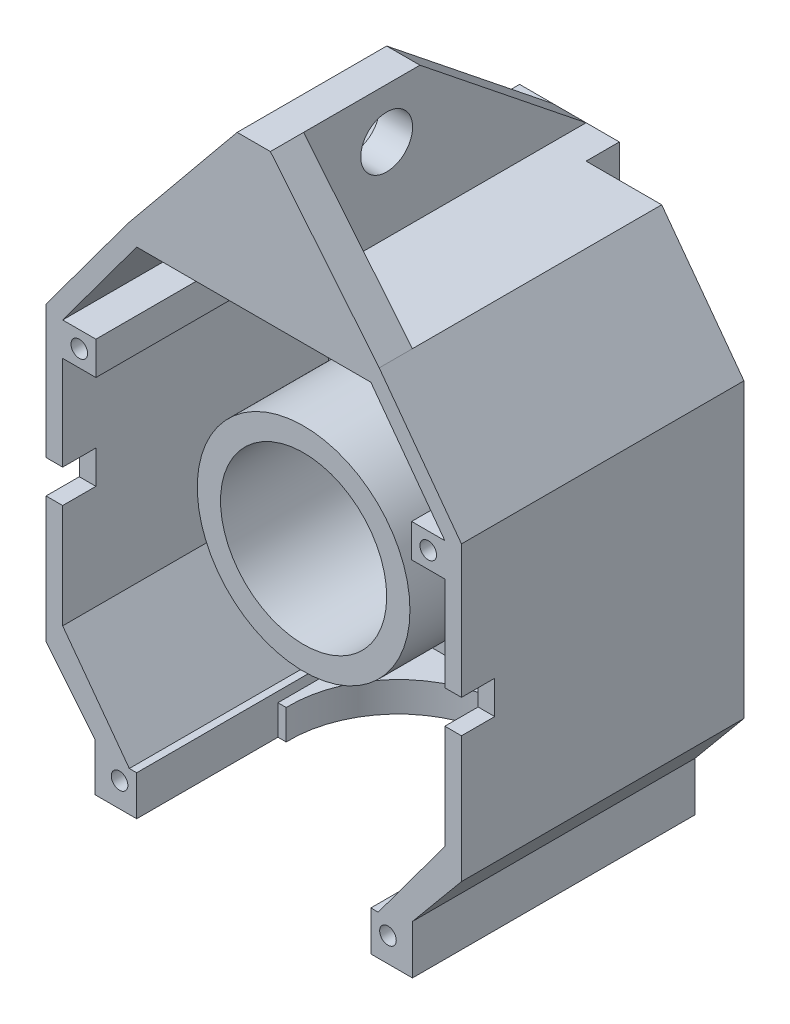
from build123d import *
from build123d.topology import SkipClean

# Parameters (mm, degrees)
ESTRUSIONE_ESTRUSIONE3_DEPTH       = 35
ESTRUSIONE_ESTRUSIONE3_DEPTH_BACK  = 35
SCHIZZO1_R                         = 32
SCHIZZO1_R_2                       = 25
SCHIZZO3D1_R                       = 32
ESTRUSIONE_ESTRUSIONE4_DEPTH       = 5
ESTRUSIONE_ESTRUSIONE13_DEPTH      = 80
TAGLIO_ESTRUSIONE1_START           = -73.5
TAGLIO_ESTRUSIONE1_OUTLINE_R       = 32.75
TAGLIO_ESTRUSIONE1_DEPTH           = 5
TAGLIO_ESTRUSIONE2_DEPTH           = 42.5
ESTRUSIONE_ESTRUSIONE14_DEPTH      = 80
SCHIZZO3D6_R                       = 2.5
TAGLIO_ESTRUSIONE3_DEPTH           = 136.020798627
SCHIZZO3D7_R                       = 4
TAGLIO_ESTRUSIONE4_DEPTH           = 3
TAGLIO_ESTRUSIONE5_DEPTH           = 42.5
TAGLIO_ESTRUSIONE6_DEPTH           = 10
ESTRUSIONE_ESTRUSIONE15_START      = 5
ESTRUSIONE_ESTRUSIONE15_DEPTH      = 5
TAGLIO_ESTRUSIONE7_START           = -3
TAGLIO_ESTRUSIONE7_DEPTH           = 3
TAGLIO_ESTRUSIONE8_START           = 3
TAGLIO_ESTRUSIONE8_DEPTH           = 3
TAGLIO_ESTRUSIONE9_DEPTH           = 10
ESTRUSIONE_ESTRUSIONE16_START      = -35
ESTRUSIONE_ESTRUSIONE16_OUTLINE_R  = 4
ESTRUSIONE_ESTRUSIONE16_DEPTH      = 10
TAGLIO_ESTRUSIONE10_DEPTH          = 80
ESTRUSIONE_ESTRUSIONE17_DEPTH      = 85
TAGLIO_ESTRUSIONE11_DEPTH          = 85
ESTRUSIONE_ESTRUSIONE18_DEPTH      = 85
ESTRUSIONE_ESTRUSIONE19_DEPTH      = 85
ESTRUSIONE_ESTRUSIONE21_DEPTH      = 85
TAGLIO_ESTRUSIONE15_START          = 26
TAGLIO_ESTRUSIONE15_DEPTH          = 26
ESTRUSIONE_ESTRUSIONE22_DEPTH      = 85
SCHIZZO3D26_R                      = 4
TAGLIO_ESTRUSIONE16_DEPTH          = 3
SCHIZZO3D27_R                      = 2.5
TAGLIO_ESTRUSIONE17_DEPTH          = 107
TAGLIO_ESTRUSIONE18_START          = -35
TAGLIO_ESTRUSIONE18_OUTLINE_R      = 3.3
TAGLIO_ESTRUSIONE18_DEPTH          = 5
ESTRUSIONE_ESTRUSIONE23_START      = -35
ESTRUSIONE_ESTRUSIONE23_OUTLINE_R  = 25
ESTRUSIONE_ESTRUSIONE23_DEPTH      = 10
ESTRUSIONE_ESTRUSIONE24_START      = 10
SCHIZZO3D31_R                      = 3.3
ESTRUSIONE_ESTRUSIONE24_DEPTH      = 10
TAGLIO_ESTRUSIONE19_DEPTH          = 5
ESTRUSIONE_ESTRUSIONE26_DEPTH      = 8
ESTRUSIONE_ESTRUSIONE26_DEPTH_BACK = 8
SCHIZZO3D36_R                      = 4
ESTRUSIONE_ESTRUSIONE28_DEPTH      = 40
TAGLIO_ESTRUSIONE20_DEPTH          = 40
ESTRUSIONE_ESTRUSIONE29_DEPTH      = 45
ESTRUSIONE_ESTRUSIONE30_DEPTH      = 10
SCHIZZO3D46_R                      = 7.8
TAGLIO_ESTRUSIONE21_DEPTH          = 10


# Read off the part's stored shape, not the designer's step: Taglio-Estrusione1, Estrusione-Estrusione16, Taglio-Estrusione18, Estrusione-Estrusione23
with BuildPart() as part:
    # Schizzo1 → Estrusione-Estrusione3 (new, two sides: drawn at the far end of the back side and taken through both)
    with BuildSketch(Plane.XY.offset(-ESTRUSIONE_ESTRUSIONE3_DEPTH_BACK)):
        Circle(SCHIZZO1_R)
        Circle(SCHIZZO1_R_2, mode=Mode.SUBTRACT)
    extrude(amount=ESTRUSIONE_ESTRUSIONE3_DEPTH + ESTRUSIONE_ESTRUSIONE3_DEPTH_BACK)

    # Schizzo3D1 → Estrusione-Estrusione4 (add)
    with BuildSketch(Plane(origin=(-62.5, 40, -35), x_dir=(0.6620037592711553, -0.749500515484051, 0), z_dir=(0, 0, 1))):
        Polygon((0, 0), (59.960041239, -52.960300742), (101.452901549, -56.587288919), (104.762920346, -52.839786342), (148.124166578, -3.747502577), (151.434185374, 0), (142.710511148, 40.727263694), (82.750469909, 93.687564436), (41.257609598, 97.314552613), (37.947590802, 93.567050035), (-5.41365543, 44.474766271), (-8.723674227, 40.727263694), align=None)
        with Locations(Location((71.355255574, 20.363631847, 0), (0, 0, 48.547129509))):
            Circle(SCHIZZO3D1_R, mode=Mode.SUBTRACT)
    extrude(amount=ESTRUSIONE_ESTRUSIONE4_DEPTH)

    # Schizzo3D2 → Estrusione-Estrusione13 (add)
    with BuildSketch(Plane(origin=(-37.75, 73.5, -30), x_dir=(0.4568693936855125, -0.889533786381064, 0), z_dir=(0, 0, 1))):
        Polygon((0, 0), (34.493639223, 67.159800872), (75.600538561, 73.870637396), (146.763241471, 37.321085901), (165.255105821, 0), (130.761466598, -67.159800872), (89.654567261, -73.870637396), (18.49186435, -37.321085901), align=None)
        Polygon((22.240991405, -33.625735993), (5.600144509, -0.040454124), (37.788832579, 62.631561059), (74.780971679, 68.67064944), (143.014114416, 33.625735993), (159.654961313, 0.040454124), (127.466273243, -62.631561059), (90.474134143, -68.67064944), align=None, mode=Mode.SUBTRACT)
    extrude(amount=ESTRUSIONE_ESTRUSIONE13_DEPTH)

    # Taglio-Estrusione1 outline → Taglio-Estrusione1 (cut)
    with BuildSketch(Plane(origin=(0, 0, 0), x_dir=(1, 0, 0), z_dir=(0, 1, 0)).offset(TAGLIO_ESTRUSIONE1_START)):
        with Locations((0, -7.5)):
            Circle(TAGLIO_ESTRUSIONE1_OUTLINE_R)
    extrude(amount=TAGLIO_ESTRUSIONE1_DEPTH, mode=Mode.SUBTRACT)

    # Schizzo3D4 → Taglio-Estrusione2 (cut)
    with BuildSketch(Plane(origin=(-32.75, -68.5, 50), x_dir=(0.997099088805763, -0.07611443425998218, 0), z_dir=(0, 0, -1))):
        Polygon((0, 0), (0.380572171, 4.985495444), (65.690562488, 0), (65.309990317, -4.985495444), align=None)
    extrude(amount=TAGLIO_ESTRUSIONE2_DEPTH, mode=Mode.SUBTRACT)

    # Schizzo3D5 → Estrusione-Estrusione14 (add)
    with BuildSketch(Plane(origin=(-57.5, -38.353317087, -30), x_dir=(0.8319168268807552, 0.5549003452446715, 0), z_dir=(0, 0, 1))):
        Polygon((0, 0), (5.549003452, 8.319168269), (13.868171721, 2.770164816), (8.319168269, -5.549003452), align=None)
        Polygon((42.564537786, 63.813539703), (50.883706055, 58.264536251), (45.334702602, 49.945367982), (37.015534334, 55.494371434), align=None)
        Polygon((95.670435091, -63.813539703), (101.219438544, -55.494371434), (92.900270275, -49.945367982), (87.351266822, -58.264536251), align=None)
        Polygon((132.685969425, -8.319168269), (124.366801156, -2.770164816), (129.915804608, 5.549003452), (138.234972877, 0), align=None)
    extrude(amount=ESTRUSIONE_ESTRUSIONE14_DEPTH)

    # Schizzo3D6 → Taglio-Estrusione3 (cut)
    with BuildSketch(Plane(origin=(-52.5, 33.353317087, 50), x_dir=(0.8440673996564301, -0.5362370975951147, 0), z_dir=(0, 0, -1))):
        with Locations(Location((0, 0, 0), (0, 0, 327.572152721))):
            Circle(SCHIZZO3D6_R)
        with Locations(Location((35.7705719, 56.304895247, 0), (0, 0, 327.572152721))):
            Circle(SCHIZZO3D6_R)
        with Locations(Location((124.397648864, 0, 0), (0, 0, 327.572152721))):
            Circle(SCHIZZO3D6_R)
        with Locations(Location((88.627076964, -56.304895247, 0), (0, 0, 327.572152721))):
            Circle(SCHIZZO3D6_R)
    extrude(amount=TAGLIO_ESTRUSIONE3_DEPTH, mode=Mode.SUBTRACT)

    # Schizzo3D7 → Taglio-Estrusione4 (cut)
    with BuildSketch(Plane(origin=(52.5, 33.353317087, -35), x_dir=(-0.8440673996564301, -0.5362370975951145, 0), z_dir=(0, 0, 1))):
        with Locations(Location((0, 0, 0), (0, 0, 147.572152721))):
            Circle(SCHIZZO3D7_R)
        with Locations(Location((35.7705719, 56.304895247, 0), (0, 0, 147.572152721))):
            Circle(SCHIZZO3D7_R)
        with Locations(Location((124.397648864, 0, 0), (0, 0, 147.572152721))):
            Circle(SCHIZZO3D7_R)
        with Locations(Location((88.627076964, -56.304895247, 0), (0, 0, 147.572152721))):
            Circle(SCHIZZO3D7_R)
    extrude(amount=TAGLIO_ESTRUSIONE4_DEPTH, mode=Mode.SUBTRACT)

    # Schizzo3D8 → Taglio-Estrusione5 (cut)
    with BuildSketch(Plane(origin=(-35.227450684, -68.5, 50), x_dir=(0.9974912873801347, -0.07078934666121361, 0), z_dir=(0, 0, -1))):
        Polygon((0, 0), (2.471235472, -0.175377115), (2.825182205, 4.812079322), (0.353946733, 4.987456437), align=None)
        Polygon((70.632097001, 0), (68.160861529, 0.175377115), (67.806914795, -4.812079322), (70.278150268, -4.987456437), align=None)
    extrude(amount=TAGLIO_ESTRUSIONE5_DEPTH, mode=Mode.SUBTRACT)

    # Schizzo3D9 → Taglio-Estrusione6 (cut)
    with BuildSketch(Plane(origin=(-62.5, 0, 50), x_dir=(0.9968152785361251, -0.07974522228289001, 0), z_dir=(0, 0, -1))):
        Polygon((0, 0), (0.797452223, 9.968152785), (5.781528616, 9.569426674), (4.984076393, -0.398726111), align=None)
        Polygon((124.601909817, -9.968152785), (125.39936204, 0), (120.415285647, 0.398726111), (119.617833424, -9.569426674), align=None)
    extrude(amount=TAGLIO_ESTRUSIONE6_DEPTH, mode=Mode.SUBTRACT)

    # Schizzo3D10 → Estrusione-Estrusione15 (add)
    with BuildSketch(Plane(origin=(-32.75, -73.5, 7.5), x_dir=(0.856419201008807, 0, -0.5162810786223304), z_dir=(0, -1, 0)).offset(ESTRUSIONE_ESTRUSIONE15_START)):
        with BuildLine():
            Line((0, 0), (-2.121736335, -1.279060911))
            Line((-2.121736335, -1.279060911), (-24.063682177, 35.118755132))
            Line((-24.063682177, 35.118755132), (-26.224041846, 33.81641065))
            Line((-26.224041846, 33.81641065), (17.659849836, -38.979221436))
            Line((17.659849836, -38.979221436), (82.319499513, 0))
            Line((82.319499513, 0), (38.43560783, 72.795632086))
            Line((38.43560783, 72.795632086), (36.27524816, 71.493287604))
            Line((36.27524816, 71.493287604), (58.217194001, 35.095471561))
            Line((58.217194001, 35.095471561), (56.095457666, 33.81641065))
            ThreePointArc((56.095457666, 33.81641065), (44.955934158, -11.139523508), (0, 0))
        make_face()
    extrude(amount=-ESTRUSIONE_ESTRUSIONE15_DEPTH)

    # Schizzo3D11 → Taglio-Estrusione7 (cut)
    with BuildSketch(Plane(origin=(32.75, -68.5, 7.5), x_dir=(-1, 0, 0), z_dir=(0, 1, 0)).offset(TAGLIO_ESTRUSIONE7_START)):
        with BuildLine():
            Line((0, 0), (-2.477450684, 0))
            ThreePointArc((-2.477450684, 0), (32.75, -35.227450684), (67.977450684, 0))
            Line((67.977450684, 0), (65.5, 0))
            ThreePointArc((65.5, 0), (32.75, -32.75), (0, 0))
        make_face()
    extrude(amount=TAGLIO_ESTRUSIONE7_DEPTH, mode=Mode.SUBTRACT)

    # Schizzo3D12 → Taglio-Estrusione8 (cut)
    with BuildSketch(Plane(origin=(35.227450684, -68.5, 7.5), x_dir=(-0.8827477435104474, 0, -0.46984723190332145), z_dir=(0, -1, 0)).offset(TAGLIO_ESTRUSIONE8_START)):
        with BuildLine():
            Line((0, 0), (17.619271196, 33.103040382))
            Line((17.619271196, 33.103040382), (79.813176398, 0))
            Line((79.813176398, 0), (62.193905202, -33.103040382))
            ThreePointArc((62.193905202, -33.103040382), (14.54543241, -47.648472792), (0, 0))
        make_face()
    extrude(amount=-TAGLIO_ESTRUSIONE8_DEPTH, mode=Mode.SUBTRACT)

    # Schizzo3D13 → Taglio-Estrusione9 (cut)
    with BuildSketch(Plane(origin=(32.75, -78.5, 7.5), x_dir=(-1, 0, 0), z_dir=(0, -1, 0))):
        with BuildLine():
            ThreePointArc((0, 0), (32.75, 32.75), (65.5, 0))
            ThreePointArc((65.5, 0), (32.75, 33.75), (0, 0))
        make_face()
    extrude(amount=-TAGLIO_ESTRUSIONE9_DEPTH, mode=Mode.SUBTRACT)

    # Estrusione-Estrusione16 outline → Estrusione-Estrusione16 (add)
    with BuildSketch(Plane.XY.offset(ESTRUSIONE_ESTRUSIONE16_START)):
        with Locations((52.5, -33.353317087)):
            Circle(ESTRUSIONE_ESTRUSIONE16_OUTLINE_R)
        with Locations((-52.5, -33.353317087)):
            Circle(ESTRUSIONE_ESTRUSIONE16_OUTLINE_R)
    extrude(amount=ESTRUSIONE_ESTRUSIONE16_DEPTH)

    # Schizzo3D15 → Taglio-Estrusione10 (cut)
    with BuildSketch(Plane(origin=(-57.5, -38.353317087, 50), x_dir=(0.9962405881956831, 0.08662961636484198, 0), z_dir=(0, 0, 1))):
        Polygon((0, 0), (0.866296164, 9.962405882), (10.828702046, 9.096109718), (9.962405882, -0.866296164), align=None)
        Polygon((104.605261761, -9.096109718), (105.471557924, 0.866296164), (115.433963806, 0), (114.567667643, -9.962405882), align=None)
    extrude(amount=-TAGLIO_ESTRUSIONE10_DEPTH, mode=Mode.SUBTRACT)

    # Schizzo3D16 → Estrusione-Estrusione17 (add)
    with BuildSketch(Plane(origin=(-62.5, -40, 50), x_dir=(0.9979469235950233, -0.06404637138221654, 0), z_dir=(0, 0, -1))):
        Polygon((0, 0), (0.512370971, 7.983575389), (27.164971657, 36.835808867), (26.8447398, 31.846074249), align=None)
        Polygon((102.163724437, 32.022528861), (101.84349258, 27.032794243), (124.397125498, -7.983575389), (124.909496469, 0), align=None)
    extrude(amount=ESTRUSIONE_ESTRUSIONE17_DEPTH)

    # Schizzo3D17 → Taglio-Estrusione11 (cut)
    with BuildSketch(Plane(origin=(-57.5, -38.353317087, -30), x_dir=(0.9996599089213338, -0.026078084580556556, 0), z_dir=(0, 0, -1))):
        Polygon((0, 0), (0.078234254, 2.998979727), (23.129376621, 32.554584597), (23.051142368, 29.55560487), align=None)
        Polygon((93.560316906, 30.71725572), (93.482082652, 27.718275993), (114.960889526, -2.998979727), (115.03912378, 0), align=None)
    extrude(amount=-TAGLIO_ESTRUSIONE11_DEPTH, mode=Mode.SUBTRACT)

    # Schizzo3D18 → Estrusione-Estrusione18 (add)
    with BuildSketch(Plane(origin=(35.227450684, -78.5, 50), x_dir=(-0.9923639585819584, 0.12334412717087637, 0), z_dir=(0, 0, -1))):
        Polygon((0, 0), (-9.923639586, 1.233441272), (-8.690198314, 11.157080858), (1.233441272, 9.923639586), align=None)
        Polygon((69.916904823, -8.690198314), (79.840544409, -9.923639586), (81.07398568, 0), (71.150346094, 1.233441272), align=None)
    extrude(amount=ESTRUSIONE_ESTRUSIONE18_DEPTH)

    # Schizzo3D21 → Estrusione-Estrusione19 (add)
    with BuildSketch(Plane(origin=(47.227450684, -68.857806459, -35), x_dir=(-0.9924893703590384, -0.12233090257297884, 0), z_dir=(0, 0, -1))):
        Polygon((0, 0), (-0.301502427, 2.446135418), (1.984978741, 0.244661805), (3.164516979, -9.325112791), (92.940045084, 1.740316936), (91.760506845, 11.310091532), (93.443983159, 14.000888755), (93.745485586, 11.554753337), (95.16968563, 0), (1.424200044, -11.554753337), align=None)
    extrude(amount=-ESTRUSIONE_ESTRUSIONE19_DEPTH)

    # Schizzo3D22 → Estrusione-Estrusione21 (add)
    with BuildSketch(Plane(origin=(62.5, -40, 50), x_dir=(-0.5008471058505845, -0.8655357742815103, -1.820429507942214e-15), z_dir=(0, 0, 1))):
        Polygon((0, 0), (0.58023617, -0.065095709), (7.098056235, 3.706477244), (30.493436296, 0), (6.924286194, 4.006776847), align=None)
    extrude(amount=-ESTRUSIONE_ESTRUSIONE21_DEPTH)

    # Schizzo3D23 → Taglio-Estrusione15 (cut)
    with SkipClean():  # the faces are left unmerged after this step: merging them gives an invalid solid
        with BuildSketch(Plane(origin=(35.227450684, -78.5, 50), x_dir=(-0.8562730712113631, 0, -0.5165234046180869), z_dir=(0, -1, 0)).offset(TAGLIO_ESTRUSIONE15_START)):
            with BuildLine():
                Line((0, 0), (21.952244696, 36.391605526))
                Line((21.952244696, 36.391605526), (24.073619002, 35.111944264))
                ThreePointArc((24.073619002, 35.111944264), (69.54922699, 47.095018917), (80.159505166, 1.279661262))
                Line((80.159505166, 1.279661262), (82.280879472, 0))
                Line((82.280879472, 0), (60.328634776, -36.391605526))
                Line((60.328634776, -36.391605526), (0, 0))
            make_face()
        extrude(amount=-TAGLIO_ESTRUSIONE15_DEPTH, mode=Mode.SUBTRACT)

    # Schizzo3D24 → Estrusione-Estrusione22 (add)
    with SkipClean():  # the faces are left unmerged after this step: merging them gives an invalid solid
        with BuildSketch(Plane(origin=(47.75, -80.5, -35), x_dir=(-0.9883033934558069, 0.1525004999458584, 1.4218125797153324e-14), z_dir=(0, 0, 1))):
            Polygon((0, 0), (0.516437262, 0.079689032), (2.667737416, -13.862148816), (2.247271892, -14.563797745), align=None)
            Polygon((96.630245967, 0), (96.017836966, 0.542270865), (93.866536813, 14.484108713), (94.382974075, 14.563797745), align=None)
        extrude(amount=ESTRUSIONE_ESTRUSIONE22_DEPTH)

    # Schizzo3D26 → Taglio-Estrusione16 (cut)
    with SkipClean():  # the faces are left unmerged after this step: merging them gives an invalid solid
        with BuildSketch(Plane(origin=(0, -80.5, -35), x_dir=(0.9837586148440444, 0.1794964838656379, -7.944923026532018e-15), z_dir=(0, 0, 1))):
            with Locations(Location((41.048605807, 0, 0), (0, 0, 349.659567204))):
                Circle(SCHIZZO3D26_R)
            with Locations(Location((-38.403516754, 14.496825156, 0), (0, 0, 349.659567204))):
                Circle(SCHIZZO3D26_R)
        extrude(amount=TAGLIO_ESTRUSIONE16_DEPTH, mode=Mode.SUBTRACT)

    # Schizzo3D27 → Taglio-Estrusione17 (cut)
    with SkipClean():  # the faces are left unmerged after this step: merging them gives an invalid solid
        with BuildSketch(Plane(origin=(0, -80.5, -35), x_dir=(-0.9837586148440446, 0.17949648386563652, 6.761636618325122e-15), z_dir=(0, 0, -1))):
            with Locations(Location((41.048605807, 0, 0), (0, 0, 169.659567204))):
                Circle(SCHIZZO3D27_R)
            with Locations(Location((-38.403516754, 14.496825156, 0), (0, 0, 169.659567204))):
                Circle(SCHIZZO3D27_R)
        extrude(amount=-TAGLIO_ESTRUSIONE17_DEPTH, mode=Mode.SUBTRACT)

    # Taglio-Estrusione18 outline → Taglio-Estrusione18 (cut)
    with SkipClean():  # the faces are left unmerged after this step: merging them gives an invalid solid
        with BuildSketch(Plane.XY.offset(TAGLIO_ESTRUSIONE18_START)):
            with Locations((0, -62.75)):
                Circle(TAGLIO_ESTRUSIONE18_OUTLINE_R)
            with Locations((0, -42.75)):
                Circle(TAGLIO_ESTRUSIONE18_OUTLINE_R)
        extrude(amount=TAGLIO_ESTRUSIONE18_DEPTH, mode=Mode.SUBTRACT)

    # Estrusione-Estrusione23 outline → Estrusione-Estrusione23 (add)
    with SkipClean():  # the faces are left unmerged after this step: merging them gives an invalid solid
        with BuildSketch(Plane.XY.offset(ESTRUSIONE_ESTRUSIONE23_START)):
            Circle(ESTRUSIONE_ESTRUSIONE23_OUTLINE_R)
        extrude(amount=ESTRUSIONE_ESTRUSIONE23_DEPTH)

    # Schizzo3D31 → Estrusione-Estrusione24 (add)
    with SkipClean():  # the faces are left unmerged after this step: merging them gives an invalid solid
        with BuildSketch(Plane(origin=(0, -80.5, -35), x_dir=(-0.09694381708766091, 0.9952898554333176, 0), z_dir=(0, 0, -1)).offset(ESTRUSIONE_ESTRUSIONE24_START)):
            Polygon((0, 0), (1.454157256, -14.929347831), (154.728794993, 0), (151.82048048, 29.858695663), (-1.454157256, 14.929347831), align=None)
            with Locations(Location((37.572192043, 3.659629095, 0), (0, 0, 95.563208821))):
                Circle(SCHIZZO3D31_R, mode=Mode.SUBTRACT)
            with Locations(Location((17.666394934, 1.720752753, 0), (0, 0, 95.563208821))):
                Circle(SCHIZZO3D31_R, mode=Mode.SUBTRACT)
        extrude(amount=-ESTRUSIONE_ESTRUSIONE24_DEPTH)

    # Schizzo3D33 → Taglio-Estrusione19 (cut)
    with SkipClean():  # the faces are left unmerged after this step: merging them gives an invalid solid
        with BuildSketch(Plane(origin=(0, -36.845222271, -45), x_dir=(0.42443387623072, -0.9054589359588683, 0), z_dir=(0, 0, -1))):
            Polygon((0, 0), (-6.366508143, 13.581884039), (22.608177807, 27.163768079), (35.341194094, 0), (6.366508143, -13.581884039), align=None)
        extrude(amount=-TAGLIO_ESTRUSIONE19_DEPTH, mode=Mode.SUBTRACT)

    # Schizzo3D42 → Estrusione-Estrusione28 (add)
    with SkipClean():  # the faces are left unmerged after this step: merging them gives an invalid solid
        with BuildSketch(Plane(origin=(0, 73.5, -45), x_dir=(0.09950371902099993, 0, 0.9950371902099892), z_dir=(0, -1, 0))):
            Polygon((0, 0), (-0.497518595, 4.975185951), (49.254340915, 9.950371902), (50.249378106, 0), (0.497518595, -4.975185951), align=None)
        extrude(amount=-ESTRUSIONE_ESTRUSIONE28_DEPTH)

    # Schizzo3D43 → Taglio-Estrusione20 (cut)
    with SkipClean():  # the faces are left unmerged after this step: merging them gives an invalid solid
        with BuildSketch(Plane(origin=(-5, 73.5, -45), x_dir=(0, 0.6246950475544246, 0.7808688094430302), z_dir=(-1, 0, 0))):
            Polygon((0, 0), (64.031242374, 0), (24.987801902, 31.234752378), align=None)
        extrude(amount=-TAGLIO_ESTRUSIONE20_DEPTH, mode=Mode.SUBTRACT)

    # Schizzo3D44 → Estrusione-Estrusione29 (add)
    with SkipClean():  # the faces are left unmerged after this step: merging them gives an invalid solid
        with BuildSketch(Plane(origin=(-5, 113.5, 5), x_dir=(0.24253562503633308, -0.970142500145332, 0), z_dir=(0, 0, 1))):
            Polygon((0, 0), (2.42535625, 9.701425001), (41.231056256, 0), (38.805700006, -9.701425001), align=None)
        extrude(amount=ESTRUSIONE_ESTRUSIONE29_DEPTH)

    # Schizzo3D45 → Estrusione-Estrusione30 (add)
    with SkipClean():  # the faces are left unmerged after this step: merging them gives an invalid solid
        with BuildSketch(Plane(origin=(5, 113.5, 50), x_dir=(-0.7302026886566491, -0.6832305858775652, -1.1852161368272007e-15), z_dir=(0, 0, 1))):
            Polygon((0, 0), (3.415085382, 51.583909234), (27.329223435, 29.208107546), align=None)
            Polygon((58.545388375, 0), (7.302026887, -6.832305859), (34.631250322, 22.375801687), align=None)
        extrude(amount=-ESTRUSIONE_ESTRUSIONE30_DEPTH)

    # Schizzo3D46 → Taglio-Estrusione21 (cut)
    with SkipClean():  # the faces are left unmerged after this step: merging them gives an invalid solid
        with BuildSketch(Plane(origin=(-5, 113.5, 15), x_dir=(0, -1, 0), z_dir=(-1, 0, 0))):
            with Locations(Location((15, 0, 0), (0, 0, 270))):
                Circle(SCHIZZO3D46_R)
        extrude(amount=-TAGLIO_ESTRUSIONE21_DEPTH, mode=Mode.SUBTRACT)


with BuildPart() as body_2:
    # Schizzo3D36 → Estrusione-Estrusione26 (new, two sides: drawn at the far end of the back side and taken through both)
    with BuildSketch(Plane(origin=(0, -59.45, -40), x_dir=(0, 0.3898402571981868, -0.9208824973185512), z_dir=(1, 0, 0)).offset(-ESTRUSIONE_ESTRUSIONE26_DEPTH_BACK)):
        with Locations(Location((32.577446186, 0, 0), (0, 0, 157.055439895))):
            Circle(SCHIZZO3D36_R)
    extrude(amount=ESTRUSIONE_ESTRUSIONE26_DEPTH + ESTRUSIONE_ESTRUSIONE26_DEPTH_BACK)


solid = Compound([part.part, body_2.part])
